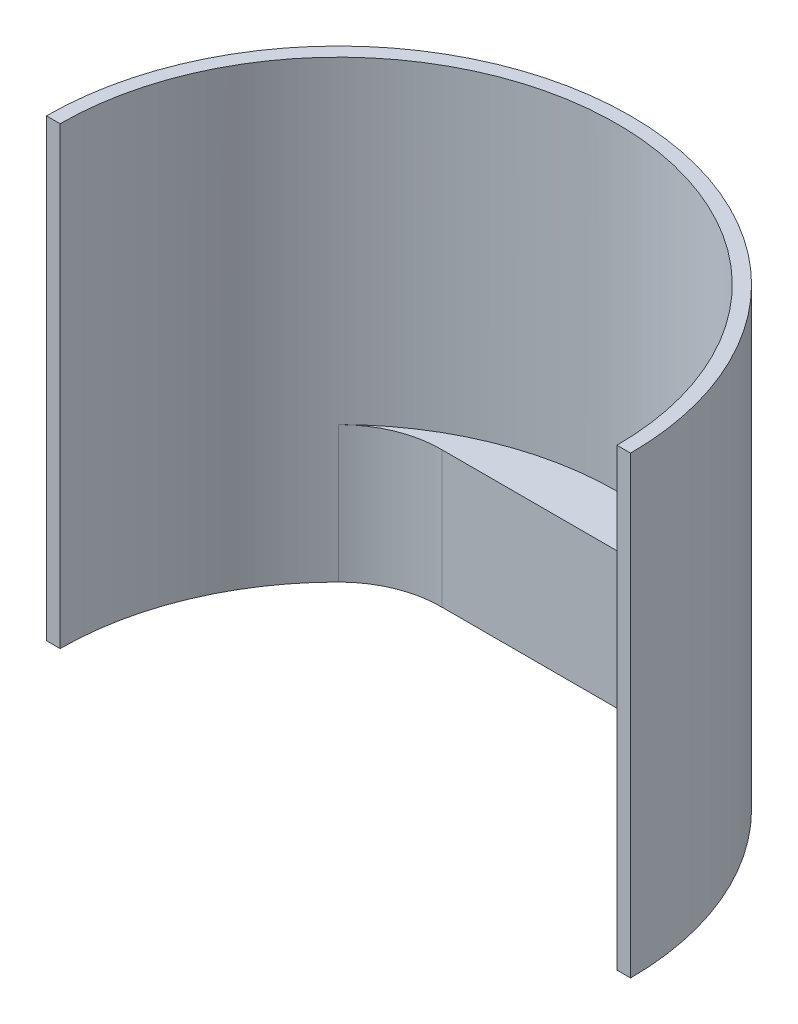
from build123d import *

# Parameters (mm, degrees)
SKETCH1_R           = 25.7
MAIN_CYLINDER_DEPTH = 40
SKETCH4_R           = 24.5
MAIN_CUT_DOWN_DEPTH = 100
BOSS_EXTRUDE1_START = 12
BOSS_EXTRUDE1_DEPTH = 12
FILLET1_DEPTH       = 12


with BuildPart() as part:
    # Sketch1 → Main Cylinder (new body)
    with BuildSketch(Plane(origin=(0, 0, 0), x_dir=(1, 0, 0), z_dir=(0, 1, 0))):
        with Locations(Location((0, 0, 0), (0, 0, 270))):
            Circle(SKETCH1_R)
    extrude(amount=MAIN_CYLINDER_DEPTH)

    # Sketch4 → Main cut down (cut)
    with BuildSketch(Plane(origin=(0, 40, 0), x_dir=(1, 0, 0), z_dir=(0, 1, 0))):
        Circle(SKETCH4_R)
        Polygon((0, 0), (25.7, 0), (25.7, -40.6), (-25.7, -40.6), (-25.7, 0), align=None)
    extrude(amount=-MAIN_CUT_DOWN_DEPTH, mode=Mode.SUBTRACT)

    # Sketch5 → Boss-Extrude1 (add)
    with BuildSketch(Plane(origin=(0, 0, 0), x_dir=(1, 0, 0), z_dir=(0, 1, 0)).offset(BOSS_EXTRUDE1_START)):
        with BuildLine():
            Line((-10.867812951, 19.957701193), (10.867812951, 19.957701193))
            Line((10.867812951, 19.957701193), (10.867812951, 21.957701193))
            ThreePointArc((10.867812951, 21.957701193), (0, 24.5), (-10.867812951, 21.957701193))
            Line((-10.867812951, 21.957701193), (-10.867812951, 19.957701193))
        make_face()
    extrude(amount=-BOSS_EXTRUDE1_DEPTH)

    # Fillet1: read off the stored shape, not the designer's step
    # Fillet1 outline → Fillet1 (add)
    with BuildSketch(Plane(origin=(0, 0, 0), x_dir=(1, 0, 0), z_dir=(0, 1, 0))):
        with BuildLine():
            Line((10.867812951, 21.957701193), (10.867812951, 19.957701193))
            ThreePointArc((10.867812951, 19.957701193), (14.363400898, 19.290736978), (17.327213424, 17.3210183))
            ThreePointArc((17.327213424, 17.3210183), (14.286867576, 19.903150878), (10.867812951, 21.957701193))
        make_face()
        with BuildLine():
            Line((-10.867812951, 19.957701193), (-10.867812951, 21.957701193))
            ThreePointArc((-10.867812951, 21.957701193), (-14.286867576, 19.903150878), (-17.327213424, 17.3210183))
            ThreePointArc((-17.327213424, 17.3210183), (-14.363400898, 19.290736978), (-10.867812951, 19.957701193))
        make_face()
    extrude(amount=FILLET1_DEPTH)


solid = part.part
